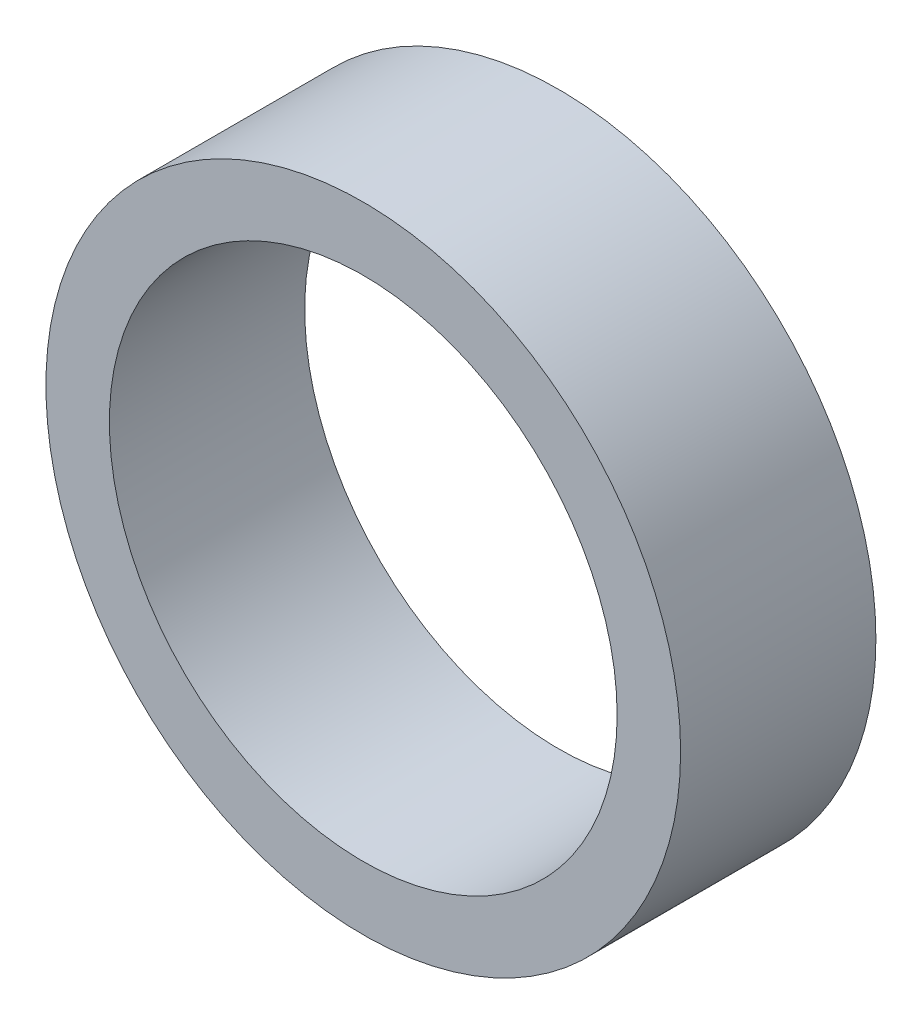
from build123d import *

# Parameters (mm, degrees)
BOSS_EXTRUDE1_START = 5
SKETCH1_R           = 3.25
SKETCH1_R_2         = 2.6
BOSS_EXTRUDE1_DEPTH = 2


with BuildPart() as part:
    # Sketch1 → Boss-Extrude1 (new body)
    with BuildSketch(Plane.XY.offset(3).offset(BOSS_EXTRUDE1_START)):
        with Locations((33, 0)):
            Circle(SKETCH1_R)
        with Locations((33, 0)):
            Circle(SKETCH1_R_2, mode=Mode.SUBTRACT)
    extrude(amount=BOSS_EXTRUDE1_DEPTH)


solid = part.part
